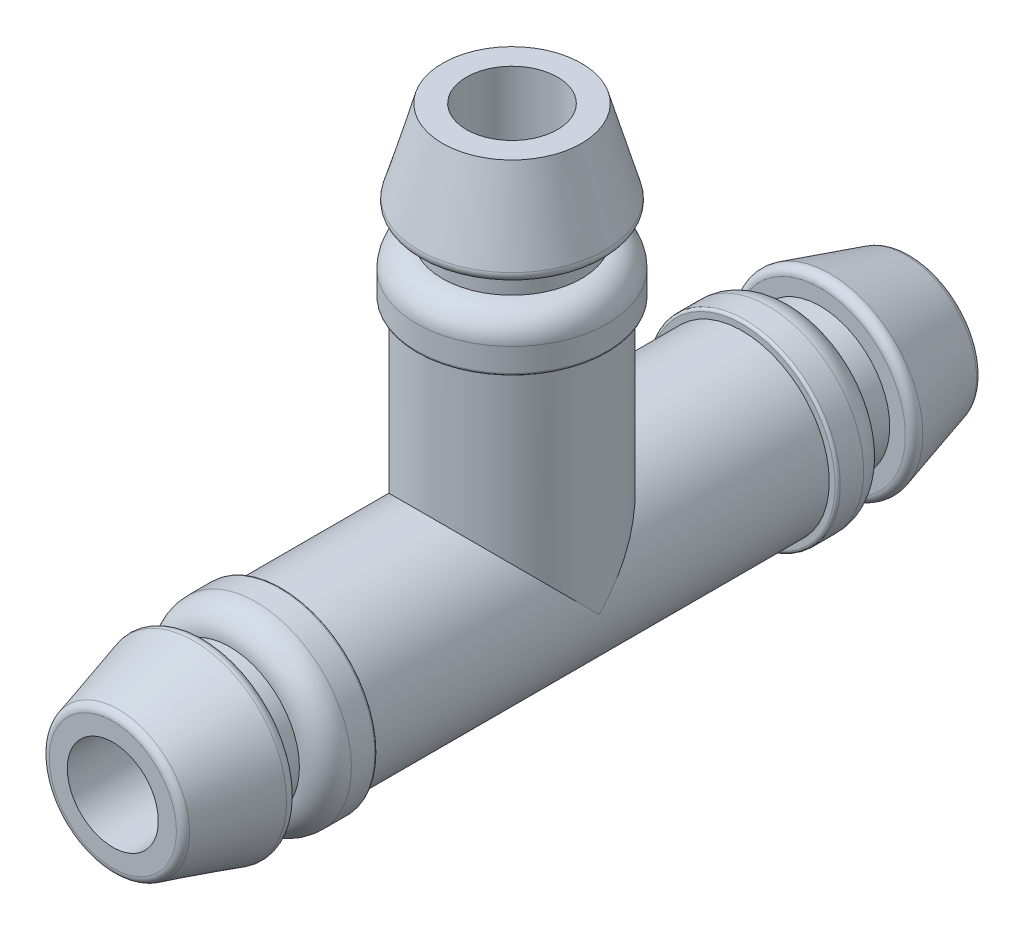
from build123d import *

# Parameters (mm, degrees)
BOSS_EXTRUDE1_DEPTH      = 8.85
BOSS_EXTRUDE1_DEPTH_BACK = 8.85
SKETCH1_R                = 3.35
SKETCH2_R                = 3.675
BOSS_EXTRUDE2_DEPTH      = 2
FILLET1_R                = 1
SKETCH4_R                = 2.675
BOSS_EXTRUDE3_DEPTH      = 1
SKETCH5_R                = 3.675
BOSS_EXTRUDE4_DEPTH      = 3.5
BOSS_EXTRUDE4_TAPER      = 16
FILLET2_R                = 0.3
FILLET3_R                = 0.1
SKETCH7_R                = 3.35
BOSS_EXTRUDE5_DEPTH      = 8.85
SKETCH6_R                = 1.75
CUT_EXTRUDE1_DEPTH       = 33.160816621
SKETCH8_R                = 3.675
BOSS_EXTRUDE6_DEPTH      = 2
FILLET4_R                = 1
SKETCH9_R                = 2.675
BOSS_EXTRUDE7_DEPTH      = 1
SKETCH10_R               = 3.675
BOSS_EXTRUDE8_DEPTH      = 3.5
BOSS_EXTRUDE8_TAPER      = 16
CUT_EXTRUDE2_REACH       = 26.72
CUT_EXTRUDE2_END_RADIUS  = 1.75
SKETCH11_R               = 1.75
FILLET5_R                = 0.3
FILLET6_R                = 0.1


# Read off the part's stored shape, not the designer's step: Mirror1
with BuildPart() as part:
    # Sketch1 → Boss-Extrude1 (new, two sides: drawn at the far end of the back side and taken through both)
    with BuildSketch(Plane.XY.offset(-BOSS_EXTRUDE1_DEPTH_BACK)):
        Circle(SKETCH1_R)
    extrude(amount=BOSS_EXTRUDE1_DEPTH + BOSS_EXTRUDE1_DEPTH_BACK)

    # Sketch2 → Boss-Extrude2 (add)
    with BuildSketch(Plane.XY.offset(8.85)):
        Circle(SKETCH2_R)
    extrude(amount=BOSS_EXTRUDE2_DEPTH)

    # Fillet1
    fillet1_edges = [part.edges().sort_by_distance(p)[0] for p in [
        (-3.675, 0, 10.85),
    ]]
    fillet(fillet1_edges, radius=FILLET1_R)

    # Sketch4 → Boss-Extrude3 (add)
    with BuildSketch(Plane.XY.offset(10.85)):
        Circle(SKETCH4_R)
    extrude(amount=BOSS_EXTRUDE3_DEPTH)

    # Sketch5 → Boss-Extrude4 (add)
    with BuildSketch(Plane.XY.offset(11.85)):
        Circle(SKETCH5_R)
    extrude(amount=BOSS_EXTRUDE4_DEPTH, taper=BOSS_EXTRUDE4_TAPER)

    # Fillet2
    fillet2_edges = [part.edges().sort_by_distance(p)[0] for p in [
        (-3.675, 0, 11.85),
        (-2.67139115, 0, 15.35),
    ]]
    fillet(fillet2_edges, radius=FILLET2_R)

    # Fillet3
    fillet3_edges = [part.edges().sort_by_distance(p)[0] for p in [
        (-3.675, 0, 8.85),
    ]]
    fillet(fillet3_edges, radius=FILLET3_R)

    # Mirror1 outline → Mirror1 (revolve)
    with BuildSketch(Plane.XZ):
        with BuildLine():
            ThreePointArc((2.675, -10.85), (3.382106781, -10.557106781), (3.675, -9.85))
            Line((3.675, -9.85), (3.675, -8.95))
            ThreePointArc((3.675, -8.95), (3.645710678, -8.879289322), (3.575, -8.85))
            Line((3.575, -8.85), (0, -8.85))
            Line((0, -8.85), (0, -15.35))
            Line((0, -15.35), (2.445324935, -15.35))
            ThreePointArc((2.445324935, -15.35), (2.625869442, -15.289590653), (2.733703444, -15.132691207))
            Line((2.733703444, -15.132691207), (3.565265062, -12.232691207))
            ThreePointArc((3.565265062, -12.232691207), (3.516477207, -11.969455493), (3.276886554, -11.85))
            Line((3.276886554, -11.85), (2.675, -11.85))
            Line((2.675, -11.85), (2.675, -10.85))
        make_face()
    revolve(axis=Axis((0, 0, 0), (0, 0, 1)))

    # Sketch7 → Boss-Extrude5 (add)
    with BuildSketch(Plane(origin=(0, 0, 0), x_dir=(1, 0, 0), z_dir=(0, 1, 0))):
        Circle(SKETCH7_R)
    extrude(amount=BOSS_EXTRUDE5_DEPTH)

    # Sketch6 → Cut-Extrude1 (cut, through all)
    with BuildSketch(Plane(origin=(0, 0, -15.35), x_dir=(-1, 0, 0), z_dir=(0, 0, -1))):
        Circle(SKETCH6_R)
    extrude(amount=-CUT_EXTRUDE1_DEPTH, mode=Mode.SUBTRACT)

    # Sketch8 → Boss-Extrude6 (add)
    with BuildSketch(Plane(origin=(0, 8.85, 0), x_dir=(1, 0, 0), z_dir=(0, 1, 0))):
        with Locations(Location((0, 0, 0), (0, 0, 270))):
            Circle(SKETCH8_R)
    extrude(amount=BOSS_EXTRUDE6_DEPTH)

    # Fillet4
    fillet4_edges = [part.edges().sort_by_distance(p)[0] for p in [
        (0, 10.85, -3.675),
    ]]
    fillet(fillet4_edges, radius=FILLET4_R)

    # Sketch9 → Boss-Extrude7 (add)
    with BuildSketch(Plane(origin=(0, 10.85, 0), x_dir=(1, 0, 0), z_dir=(0, 1, 0))):
        with Locations(Location((0, 0, 0), (0, 0, 270))):
            Circle(SKETCH9_R)
    extrude(amount=BOSS_EXTRUDE7_DEPTH)

    # Sketch10 → Boss-Extrude8 (add)
    with BuildSketch(Plane(origin=(0, 11.85, 0), x_dir=(1, 0, 0), z_dir=(0, 1, 0))):
        with Locations(Location((0, 0, 0), (0, 0, 270))):
            Circle(SKETCH10_R)
    extrude(amount=BOSS_EXTRUDE8_DEPTH, taper=BOSS_EXTRUDE8_TAPER)

    # Cut-Extrude2: up to this cylinder (the profile starts outside it)
    cut_extrude2_end = Plane(origin=(0, 0, 0), z_dir=(0, 0, -1)) * Cylinder(CUT_EXTRUDE2_END_RADIUS, 57.94, mode=Mode.PRIVATE)
    # Sketch11 → Cut-Extrude2 (cut, up to the surface)
    with BuildSketch(Plane(origin=(0, 15.35, 0), x_dir=(1, 0, 0), z_dir=(0, 1, 0)), mode=Mode.PRIVATE) as cut_extrude2_sk1:
        with Locations(Location((0, 0, 0), (0, 0, 270))):
            Circle(SKETCH11_R)
    cut_extrude2_tool1 = extrude(cut_extrude2_sk1.sketch, amount=-CUT_EXTRUDE2_REACH, mode=Mode.PRIVATE) - cut_extrude2_end
    add(cut_extrude2_tool1.solids().sort_by_distance((0, 15.35, 0))[0], mode=Mode.SUBTRACT)

    # Fillet5
    fillet5_edges = [part.edges().sort_by_distance(p)[0] for p in [
        (0, 11.85, -3.675),
    ]]
    fillet(fillet5_edges, radius=FILLET5_R)

    # Fillet6
    fillet6_edges = [part.edges().sort_by_distance(p)[0] for p in [
        (0, 8.85, -3.675),
    ]]
    fillet(fillet6_edges, radius=FILLET6_R)


solid = part.part
